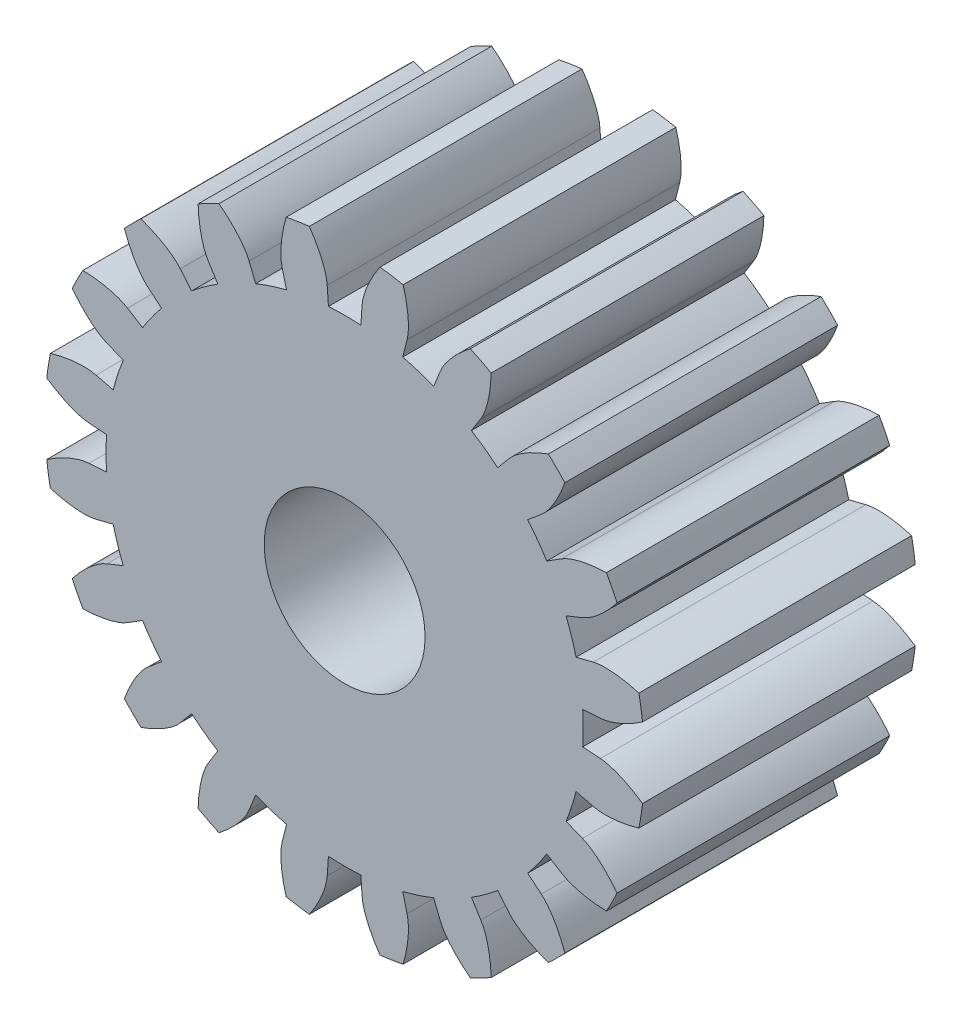
from build123d import *

# Parameters (mm, degrees)
SKETCH_1_R               = 5.5
SKETCH_1_R_2             = 1.475
EXTRUDE_1_DEPTH          = 5
CUT_EXTRUDE_1_DEPTH      = 10.246621004
PATTERN_CIRCULAR_1_COUNT = 20
PATTERN_CIRCULAR_1_ANGLE = 342


with BuildPart() as part:
    # 草图1 → 凸台-拉伸1 (new body)
    with BuildSketch(Plane.XY):
        Circle(SKETCH_1_R)
        Circle(SKETCH_1_R_2, mode=Mode.SUBTRACT)
    extrude(amount=EXTRUDE_1_DEPTH)

    # 草图1<3> → 切除-拉伸1 (cut, through all)
    with BuildSketch(Plane.XY):
        with BuildLine():
            Line((4.68759624, 0.319369739), (4.364881259, 0.297382905))
            ThreePointArc((4.364881259, 0.297382905), (4.372469583, 0.148777503), (4.375, 0))
            ThreePointArc((4.375, 0), (4.372469583, -0.148777503), (4.364881259, -0.297382905))
            Line((4.364881259, -0.297382905), (4.68759624, -0.319369739))
            add(Edge.make_bspline(
                [(4.68759624, -0.319369739), (4.723328518, -0.321804208), (4.822539562, -0.336024472), (5.006239619, -0.392562489), (5.199142564, -0.482491423), (5.35109765, -0.572850293), (5.444197274, -0.635344688), (5.461765036, -0.647396861)],
                knots=[0, 0, 0, 0, 0, 0.005604068, 0.015718248, 0.029959916, 0.033300536, 0.033300536, 0.033300536, 0.033300536, 0.033300536], degree=4))
            ThreePointArc((5.461765036, -0.647396861), (5.490432938, -0.324262474), (5.5, 0))
            ThreePointArc((5.5, 0), (5.490432938, 0.324262474), (5.461765036, 0.647396861))
            add(Edge.make_bspline(
                [(4.68759624, 0.319369739), (4.723328518, 0.321804208), (4.822539562, 0.336024472), (5.006239619, 0.392562489), (5.199142564, 0.482491423), (5.35109765, 0.572850293), (5.444197274, 0.635344688), (5.461765036, 0.647396861)],
                knots=[0, 0, 0, 0, 0, 0.005604068, 0.015718248, 0.029959916, 0.033300536, 0.033300536, 0.033300536, 0.033300536, 0.033300536], degree=4))
        make_face()
    cut_extrude_1 = extrude(amount=CUT_EXTRUDE_1_DEPTH, mode=Mode.SUBTRACT)

    # 阵列(圆周)1: 切除-拉伸1 ×20 about axis
    pattern_circular_1_axis = Axis((0, 0, 5), (0, 0, 1))
    for i in range(1, PATTERN_CIRCULAR_1_COUNT):
        add(cut_extrude_1.rotate(pattern_circular_1_axis, i * PATTERN_CIRCULAR_1_ANGLE / (PATTERN_CIRCULAR_1_COUNT - 1)), mode=Mode.SUBTRACT)


solid = part.part
